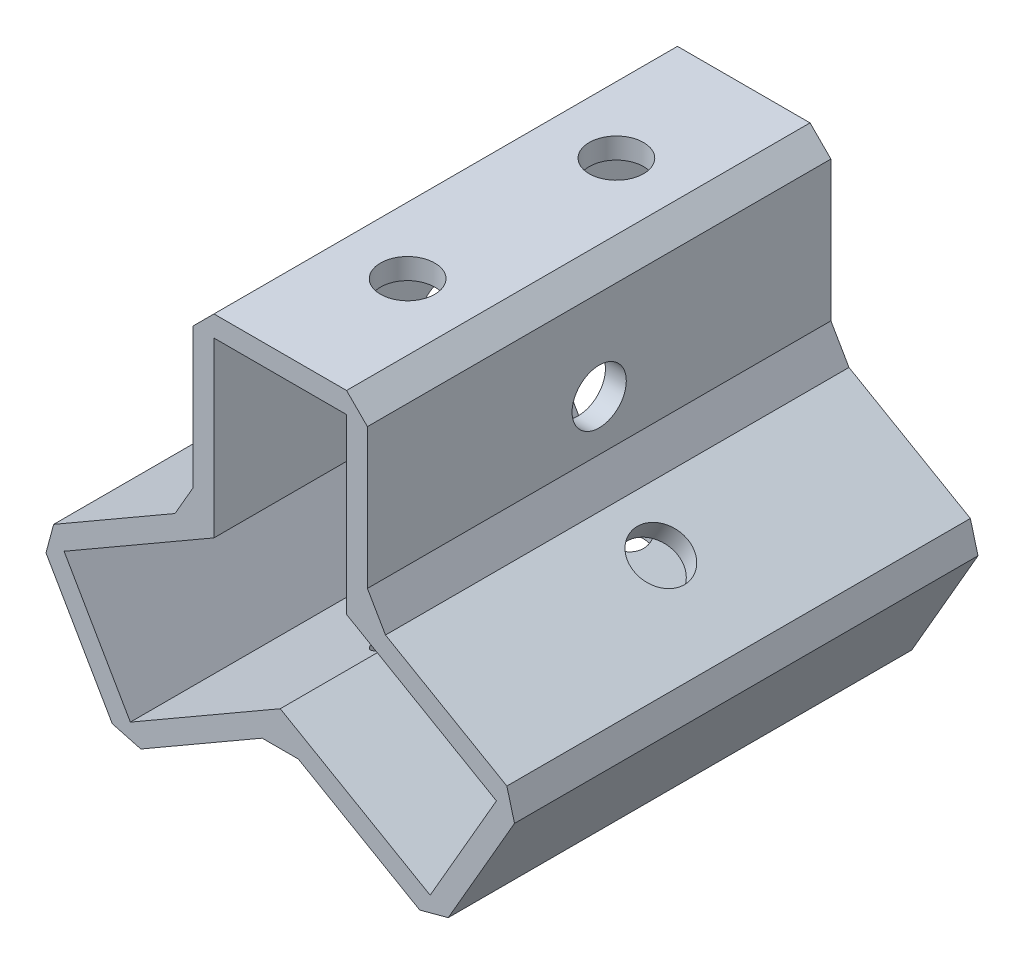
from build123d import *

# Parameters (mm, degrees)
BOSS_EXTRUDE1_DEPTH = 44.4
SKETCH4_R           = 2.6
CUT_EXTRUDE1_DEPTH  = 59.211840581
SKETCH6_R           = 2.6
CUT_EXTRUDE2_DEPTH  = 65.569616831
CHAMFER1_SIZE       = 2
SKETCH7_R           = 2.6
CUT_EXTRUDE3_DEPTH  = 59.43220581
SKETCH9_R           = 2.6
CUT_EXTRUDE4_DEPTH  = 60.570802035


with BuildPart() as part:
    # Sketch1 → Boss-Extrude1 (new body)
    with BuildSketch(Plane.XY):
        Polygon((-8.35, 22.246174209), (-8.35, 4.820874748), (-23.440752002, -3.891774983), (-15.090752002, -18.354399226), (0, -9.641749495), (15.090752002, -18.354399226), (23.440752002, -3.891774983), (8.35, 4.820874748), (8.35, 22.246174209), align=None)
        Polygon((-20.708701195, -4.623825791), (-6.35, 3.666174209), (-6.35, 20.246174209), (6.35, 20.246174209), (6.35, 3.666174209), (20.708701195, -4.623825791), (14.358701195, -15.622348419), (0, -7.332348419), (-14.358701195, -15.622348419), align=None, mode=Mode.SUBTRACT)
    extrude(amount=BOSS_EXTRUDE1_DEPTH)

    # Sketch4 → Cut-Extrude1 (cut, through all)
    with BuildSketch(Plane(origin=(-4.175, 7.231312122, 0), x_dir=(0.8660254037844606, 0.4999999999999621, 0), z_dir=(-0.4999999999999621, 0.8660254037844606, 0))):
        with Locations((-11.644441584, -22.2)):
            Circle(SKETCH4_R)
    extrude(amount=-CUT_EXTRUDE1_DEPTH, mode=Mode.SUBTRACT)

    # Sketch6 → Cut-Extrude2 (cut, through all)
    with BuildSketch(Plane(origin=(0, 22.246174209, 0), x_dir=(1, 0, 0), z_dir=(0, 1, 0))):
        with Locations((0, -12.2)):
            Circle(SKETCH6_R)
        with Locations((0, -32.2)):
            Circle(SKETCH6_R)
    extrude(amount=-CUT_EXTRUDE2_DEPTH, mode=Mode.SUBTRACT)

    # Chamfer1
    chamfer1_edges = [part.edges().sort_by_distance(p)[0] for p in [
        (-8.35, 4.820874748, 22.2),
        (-8.35, 22.246174209, 22.2),
        (8.35, 22.246174209, 22.2),
        (8.35, 4.820874748, 22.2),
        (23.440752002, -3.891774983, 22.2),
        (0, -9.641749495, 4.8),
        (0, -9.641749495, 22.2),
        (15.090752002, -18.354399226, 22.2),
        (0, -9.641749495, 39.6),
        (-23.440752002, -3.891774983, 22.2),
        (-15.090752002, -18.354399226, 22.2),
    ]]
    chamfer(chamfer1_edges, length=CHAMFER1_SIZE)

    # Sketch7 → Cut-Extrude3 (cut, through all)
    with BuildSketch(Plane(origin=(8.35, 0, 0), x_dir=(0, 0, -1), z_dir=(1, 0, 0))):
        with Locations((-22.2, 11.644441584)):
            Circle(SKETCH7_R)
    extrude(amount=-CUT_EXTRUDE3_DEPTH, mode=Mode.SUBTRACT)

    # Sketch9 → Cut-Extrude4 (cut, through all)
    with BuildSketch(Plane(origin=(-4.175, -7.231312122, 0), x_dir=(0.8660254037844506, -0.49999999999997924, 0), z_dir=(-0.4999999999999793, -0.8660254037844507, 0))):
        with Locations((11.644441584, 22.2)):
            Circle(SKETCH9_R)
    extrude(amount=-CUT_EXTRUDE4_DEPTH, mode=Mode.SUBTRACT)


solid = part.part
